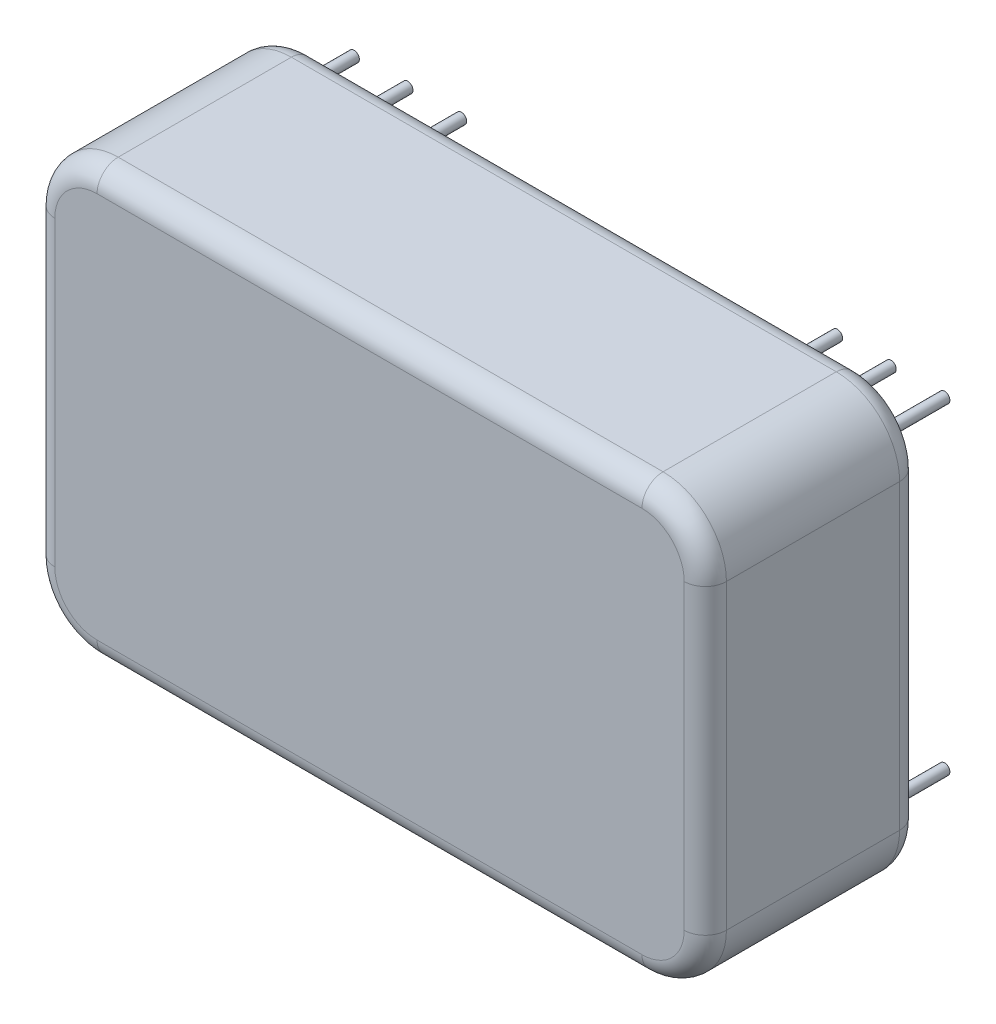
from build123d import *

# Parameters (mm, degrees)
SKETCH_1_W      = 31.8
SKETCH_1_H      = 20.3
EXTRUDE_1_DEPTH = 10.2
FILLET_2_R      = 1
FILLET_1_R      = 3
SKETCH_2_R      = 0.25
EXTRUDE_2_DEPTH = 3.05


with BuildPart() as part:
    # Эскиз1 → Бобышка-Вытянуть1 (new body)
    with BuildSketch(Plane.XY):
        Rectangle(SKETCH_1_W, SKETCH_1_H)
    extrude(amount=EXTRUDE_1_DEPTH)

    # Скругление2
    fillet_2_edges = [part.edges().sort_by_distance(p)[0] for p in [
        (-15.9, 0, 10.2),
        (0, -10.15, 10.2),
        (15.9, 0, 10.2),
        (0, -10.15, 0),
        (-15.9, 0, 0),
        (0, 10.15, 0),
        (15.9, 0, 0),
        (0, 10.15, 10.2),
    ]]
    fillet(fillet_2_edges, radius=FILLET_2_R)

    # Скругление1
    # the kernel refuses this fillet: 3 mm, written as the material it takes off along each edge
    with BuildSketch(Plane(origin=(12.9, -7.15, 0), x_dir=(1, 0, 0), z_dir=(0, 1, 0))) as fillet_1_piece_1:
        with BuildLine():
            CenterArc((2, -1), 1, 0, 90)
            Line((3, -1), (3, 0))
            Line((3, 0), (2, 0))
        make_face()
    revolve(axis=Axis((12.9, -7.15, 0), (0, 0, -1)), revolution_arc=90, mode=Mode.SUBTRACT)
    with BuildSketch(Plane(origin=(-12.9, -7.15, 0), x_dir=(0, -1, 0), z_dir=(1, 0, 0))) as fillet_1_piece_2:
        with BuildLine():
            CenterArc((2, -1), 1, 0, 90)
            Line((3, -1), (3, 0))
            Line((3, 0), (2, 0))
        make_face()
    revolve(axis=Axis((-12.9, -7.15, 0), (0, 0, -1)), revolution_arc=90, mode=Mode.SUBTRACT)
    with BuildSketch(Plane(origin=(12.9, 7.15, 0), x_dir=(0, 1, 0), z_dir=(-1, 0, 0))) as fillet_1_piece_3:
        with BuildLine():
            CenterArc((2, -1), 1, 0, 90)
            Line((3, -1), (3, 0))
            Line((3, 0), (2, 0))
        make_face()
    revolve(axis=Axis((12.9, 7.15, 0), (0, 0, -1)), revolution_arc=90, mode=Mode.SUBTRACT)
    with BuildSketch(Plane(origin=(-12.9, 7.15, 0), x_dir=(-1, 0, 0), z_dir=(0, -1, 0))) as fillet_1_piece_4:
        with BuildLine():
            CenterArc((2, -1), 1, 0, 90)
            Line((3, -1), (3, 0))
            Line((3, 0), (2, 0))
        make_face()
    revolve(axis=Axis((-12.9, 7.15, 0), (0, 0, -1)), revolution_arc=90, mode=Mode.SUBTRACT)
    with BuildSketch(Plane(origin=(12.9, -7.15, 10.2), x_dir=(0, -1, 0), z_dir=(-1, 0, 0))) as fillet_1_piece_5:
        with BuildLine():
            CenterArc((2, -1), 1, 0, 90)
            Line((3, -1), (3, 0))
            Line((3, 0), (2, 0))
        make_face()
    revolve(axis=Axis((12.9, -7.15, 10.2), (0, 0, 1)), revolution_arc=90, mode=Mode.SUBTRACT)
    with BuildSketch(Plane(origin=(-12.9, -7.15, 10.2), x_dir=(-1, 0, 0), z_dir=(0, 1, 0))) as fillet_1_piece_6:
        with BuildLine():
            CenterArc((2, -1), 1, 0, 90)
            Line((3, -1), (3, 0))
            Line((3, 0), (2, 0))
        make_face()
    revolve(axis=Axis((-12.9, -7.15, 10.2), (0, 0, 1)), revolution_arc=90, mode=Mode.SUBTRACT)
    with BuildSketch(Plane(origin=(12.9, 7.15, 10.2), x_dir=(1, 0, 0), z_dir=(0, -1, 0))) as fillet_1_piece_7:
        with BuildLine():
            CenterArc((2, -1), 1, 0, 90)
            Line((3, -1), (3, 0))
            Line((3, 0), (2, 0))
        make_face()
    revolve(axis=Axis((12.9, 7.15, 10.2), (0, 0, 1)), revolution_arc=90, mode=Mode.SUBTRACT)
    with BuildSketch(Plane(origin=(-12.9, 7.15, 10.2), x_dir=(0, 1, 0), z_dir=(1, 0, 0))) as fillet_1_piece_8:
        with BuildLine():
            CenterArc((2, -1), 1, 0, 90)
            Line((3, -1), (3, 0))
            Line((3, 0), (2, 0))
        make_face()
    revolve(axis=Axis((-12.9, 7.15, 10.2), (0, 0, 1)), revolution_arc=90, mode=Mode.SUBTRACT)
    with BuildSketch(Plane(origin=(-15.9, 10.15, 0), x_dir=(0, -1, 0), z_dir=(0, 0, 1)), Plane(origin=(-15.9, -10.15, 0), x_dir=(1, 0, 0), z_dir=(0, 0, 1))) as fillet_1_piece_9:
        with BuildLine():
            CenterArc((FILLET_1_R, FILLET_1_R), FILLET_1_R, 180, 90)
            Line((0, FILLET_1_R), (0, 0))
            Line((0, 0), (FILLET_1_R, 0))
        make_face()
    extrude(amount=10.2, mode=Mode.SUBTRACT)
    with BuildSketch(Plane(origin=(15.9, 10.15, 0), x_dir=(0, -1, 0), z_dir=(0, 0, 1)), Plane(origin=(15.9, -10.15, 0), x_dir=(-1, 0, 0), z_dir=(0, 0, 1))) as fillet_1_piece_10:
        with BuildLine():
            CenterArc((FILLET_1_R, -FILLET_1_R), FILLET_1_R, 90, 90)
            Line((0, -FILLET_1_R), (0, 0))
            Line((0, 0), (FILLET_1_R, 0))
        make_face()
    extrude(amount=10.2, mode=Mode.SUBTRACT)

    # Эскиз2 → Бобышка-Вытянуть2 (add)
    with BuildSketch(Plane(origin=(0, 0, 0), x_dir=(-1, 0, 0), z_dir=(0, 0, -1))):
        with Locations((13.98, 7.62)):
            Circle(SKETCH_2_R)
        with Locations((8.9, 7.62)):
            Circle(SKETCH_2_R)
        with Locations((-11.44, 7.62)):
            Circle(SKETCH_2_R)
        with Locations((-13.98, 7.62)):
            Circle(SKETCH_2_R)
        with Locations((-13.98, -7.62)):
            Circle(SKETCH_2_R)
        with Locations((-11.44, -7.62)):
            Circle(SKETCH_2_R)
        with Locations((8.9, -7.62)):
            Circle(SKETCH_2_R)
        with Locations((13.98, -7.62)):
            Circle(SKETCH_2_R)
        with Locations((-8.9, 7.62)):
            Circle(SKETCH_2_R)
        with Locations((-8.9, -7.62)):
            Circle(SKETCH_2_R)
        with Locations((11.44, 7.62)):
            Circle(SKETCH_2_R)
        with Locations((11.44, -7.62)):
            Circle(SKETCH_2_R)
    extrude(amount=EXTRUDE_2_DEPTH)


solid = part.part
